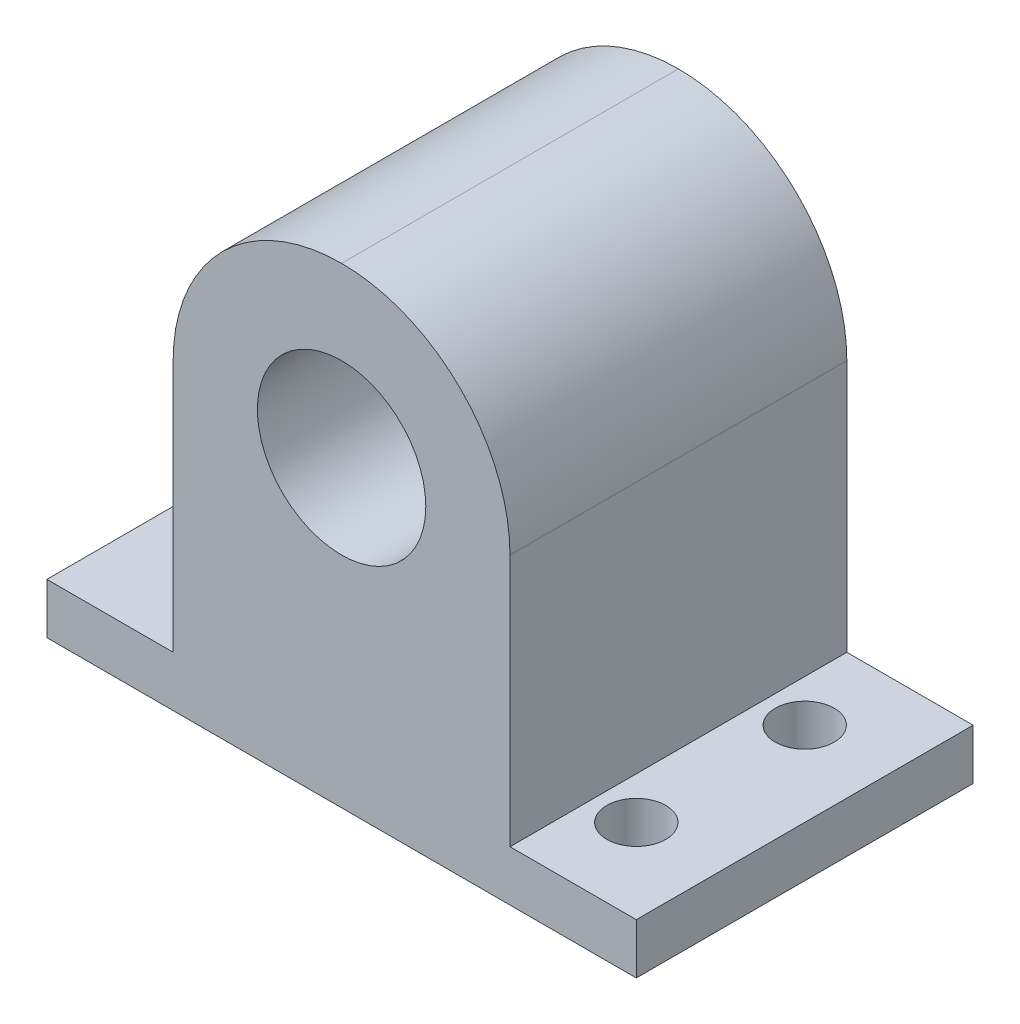
from build123d import *

# Parameters (mm, degrees)
SKETCH_1_W          = 35
SKETCH_1_H          = 3
SKETCH_1_W_2        = 20
SKETCH_1_H_2        = 25
EXTRUDE_1_DEPTH     = 20
FILLET_1_R          = 10
FILLET_2_R          = 10
CUT_EXTRUDE_1_REACH = 51.082
SKETCH_2_R          = 5
CUT_EXTRUDE_2_REACH = 49.434
SKETCH_4_R          = 1.75


with BuildPart() as part:
    # 草图1 → 凸台-拉伸1 (new body)
    with BuildSketch(Plane.XY):
        with Locations((17.5, 1.5)):
            Rectangle(SKETCH_1_W, SKETCH_1_H)
        with Locations((17.5, 15.5)):
            Rectangle(SKETCH_1_W_2, SKETCH_1_H_2)
    extrude(amount=EXTRUDE_1_DEPTH)

    # 圆角1
    fillet_1_edges = [part.edges().sort_by_distance(p)[0] for p in [
        (27.5, 28, 10),
    ]]
    fillet(fillet_1_edges, radius=FILLET_1_R)

    # 圆角2
    fillet_2_edges = [part.edges().sort_by_distance(p)[0] for p in [
        (7.5, 28, 10),
    ]]
    fillet(fillet_2_edges, radius=FILLET_2_R - 0.0001)  # a hair under: the kernel refuses the full size

    # 草图2 → 切除-拉伸1 (cut, up to next)
    with BuildSketch(Plane.XY.offset(20), mode=Mode.PRIVATE) as cut_extrude_1_sk1:
        with Locations((17.5, 18)):
            Circle(SKETCH_2_R)
    cut_extrude_1_tool1 = extrude(cut_extrude_1_sk1.sketch, amount=-CUT_EXTRUDE_1_REACH, mode=Mode.PRIVATE) & part.part
    add(cut_extrude_1_tool1.solids().sort_by_distance((17.5, 18, 20))[0], mode=Mode.SUBTRACT)

    # 草图4 → 切除-拉伸2 (cut, up to next)
    with BuildSketch(Plane(origin=(0, 3, 0), x_dir=(1, 0, 0), z_dir=(0, 1, 0)), mode=Mode.PRIVATE) as cut_extrude_2_sk1:
        with Locations(Location((30, -15, 0), (0, 0, 270))):
            Circle(SKETCH_4_R)
    cut_extrude_2_tool1 = extrude(cut_extrude_2_sk1.sketch, amount=-CUT_EXTRUDE_2_REACH, mode=Mode.PRIVATE) & part.part
    # 草图4 → 切除-拉伸2 (cut, up to next)
    with BuildSketch(Plane(origin=(0, 3, 0), x_dir=(1, 0, 0), z_dir=(0, 1, 0)), mode=Mode.PRIVATE) as cut_extrude_2_sk2:
        with Locations(Location((30, -5, 0), (0, 0, 270))):
            Circle(SKETCH_4_R)
    cut_extrude_2_tool2 = extrude(cut_extrude_2_sk2.sketch, amount=-CUT_EXTRUDE_2_REACH, mode=Mode.PRIVATE) & part.part
    # 草图4 → 切除-拉伸2 (cut, up to next)
    with BuildSketch(Plane(origin=(0, 3, 0), x_dir=(1, 0, 0), z_dir=(0, 1, 0)), mode=Mode.PRIVATE) as cut_extrude_2_sk3:
        with Locations(Location((5, -15, 0), (0, 0, 270))):
            Circle(SKETCH_4_R)
    cut_extrude_2_tool3 = extrude(cut_extrude_2_sk3.sketch, amount=-CUT_EXTRUDE_2_REACH, mode=Mode.PRIVATE) & part.part
    # 草图4 → 切除-拉伸2 (cut, up to next)
    with BuildSketch(Plane(origin=(0, 3, 0), x_dir=(1, 0, 0), z_dir=(0, 1, 0)), mode=Mode.PRIVATE) as cut_extrude_2_sk4:
        with Locations(Location((5, -5, 0), (0, 0, 270))):
            Circle(SKETCH_4_R)
    cut_extrude_2_tool4 = extrude(cut_extrude_2_sk4.sketch, amount=-CUT_EXTRUDE_2_REACH, mode=Mode.PRIVATE) & part.part
    add(cut_extrude_2_tool1.solids().sort_by_distance((30, 3, 15))[0], mode=Mode.SUBTRACT)
    add(cut_extrude_2_tool2.solids().sort_by_distance((30, 3, 5))[0], mode=Mode.SUBTRACT)
    add(cut_extrude_2_tool3.solids().sort_by_distance((5, 3, 15))[0], mode=Mode.SUBTRACT)
    add(cut_extrude_2_tool4.solids().sort_by_distance((5, 3, 5))[0], mode=Mode.SUBTRACT)


solid = part.part
